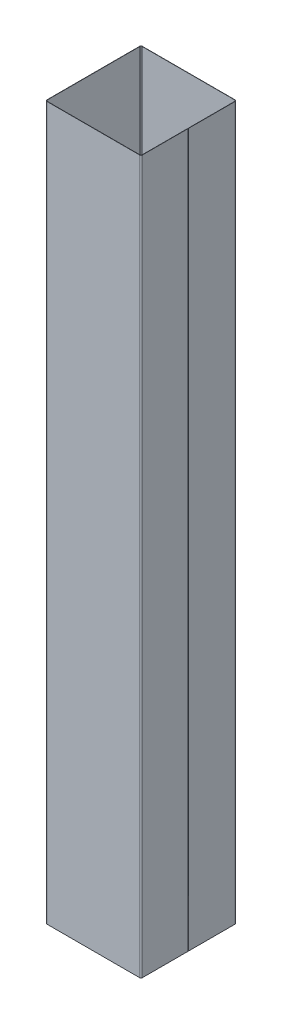
from build123d import *

# Parameters (mm, degrees)
SM_BASE_FLANGE_1_DEPTH = 600


# Sheet-metal steps are written as plain solids
with BuildPart() as part:
    # Sketch 1 → 基体-法兰1 (new body)
    with BuildSketch(Plane(origin=(0, 0, 0), x_dir=(1, 0, 0), z_dir=(0, 1, 0))):
        with BuildLine():
            Line((40, -0.5), (40, -39))
            ThreePointArc((40, -39), (39.707106781, -39.707106781), (39, -40))
            Line((39, -40), (-39, -40))
            ThreePointArc((-39, -40), (-39.707106781, -39.707106781), (-40, -39))
            Line((-40, -39), (-40, 39))
            ThreePointArc((-40, 39), (-39.707106781, 39.707106781), (-39, 40))
            Line((-39, 40), (39, 40))
            ThreePointArc((39, 40), (39.707106781, 39.707106781), (40, 39))
            Line((40, 39), (40, 0))
            Line((40, 0), (40.2, 0))
            Line((40.2, 0), (40.2, 39))
            ThreePointArc((40.2, 39), (39.848528137, 39.848528137), (39, 40.2))
            Line((39, 40.2), (-39, 40.2))
            ThreePointArc((-39, 40.2), (-39.848528137, 39.848528137), (-40.2, 39))
            Line((-40.2, 39), (-40.2, -39))
            ThreePointArc((-40.2, -39), (-39.848528137, -39.848528137), (-39, -40.2))
            Line((-39, -40.2), (39, -40.2))
            ThreePointArc((39, -40.2), (39.848528137, -39.848528137), (40.2, -39))
            Line((40.2, -39), (40.2, -0.5))
            Line((40.2, -0.5), (40, -0.5))
        make_face()
    extrude(amount=SM_BASE_FLANGE_1_DEPTH)


solid = part.part
